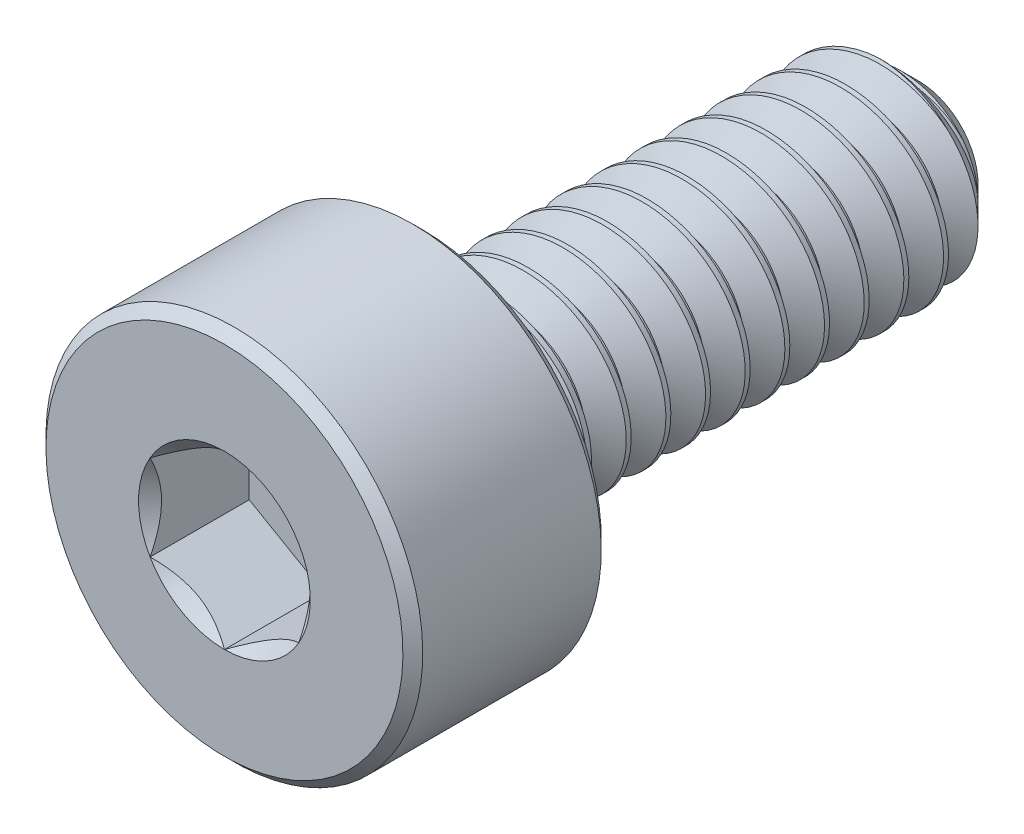
from build123d import *

# Parameters (mm, degrees)
CUT_EXTRUDE1_DEPTH = 1
CUT_SWEEP1_PITCH   = 0.4
CUT_SWEEP1_TO      = 5


with BuildPart() as part:
    # Sketch2 → Revolve1 (revolve)
    with BuildSketch(Plane(origin=(0, 0, 0), x_dir=(0, 0, -1), z_dir=(1, 0, 0))):
        Polygon((-3.5, 0), (-3.5, 1.8), (-3.4, 1.9), (-1.6, 1.9), (-1.5, 1.8), (-1.5, 1), (3.1, 1), (3.5, 0.6), (3.5, 0), align=None)
    revolve(axis=Axis((0, 0, -3.5), (0, 0, 1)))

    # Sketch3 → Cut-Extrude1 (cut)
    with BuildSketch(Plane.XY.offset(3.5)):
        Polygon((0.75, -0.433012702), (0.75, 0.433012702), (0, 0.866025404), (-0.75, 0.433012702), (-0.75, -0.433012702), (0, -0.866025404), align=None)
    extrude(amount=-CUT_EXTRUDE1_DEPTH, mode=Mode.SUBTRACT)

    # Cut-Extrude2 cone 1 section (through the dimple's axis) → Cut-Extrude2 (revolve, cut)
    with BuildSketch(Plane(origin=(0, 0, 3.5), x_dir=(0, -1, 0), z_dir=(1, 0, 0))):
        Polygon((0, 0), (0.866025404, 0), (0, 0.866025404), align=None)
    revolve(axis=Axis((0, 0, 3.5), (0, 0, -1)), mode=Mode.SUBTRACT)


with BuildPart() as body_2:
    # Split1: read off the stored shape, not the designer's step
    # Split1: the piece on the far side of the plane
    add(part.part)
    split(bisect_by=Plane.XY.offset(1.5), keep=Keep.BOTTOM)

    # Cut-Sweep1: arcs per turn and ends read off the stored shape
    # Cut-Sweep1: the profile of Sketch7 screwed along a right-hand helix through 13.65 turns, 6 arcs to a turn; built about Z, then put on its axis
    cut_sweep1_z = Axis((0, 0, 0), (0, 0, 1))
    cut_sweep1_corners = [(1.021650635, 0, 0.0125), (1.021650635, 0, -0.3625), (0.740192379, 0, -0.2), (0.740192379, 0, -0.15)]
    with BuildLine(mode=Mode.PRIVATE) as cut_sweep1_profile:
        Line(cut_sweep1_corners[0], cut_sweep1_corners[1])
        Line(cut_sweep1_corners[1], cut_sweep1_corners[2])
        Line(cut_sweep1_corners[2], cut_sweep1_corners[3])
        Line(cut_sweep1_corners[3], cut_sweep1_corners[0])
    cut_sweep1_cap = Face(cut_sweep1_profile.wire())
    cut_sweep1_turn_angles = [0, 30, 60, 90, 120, 150, 180, 210, 240, 270, 300, 330, 360]
    cut_sweep1_turn_weights = [1, 0.8660254037844387, 1, 0.8660254037844387, 1, 0.8660254037844387, 1, 0.8660254037844387, 1, 0.8660254037844387, 1, 0.8660254037844387, 1]
    cut_sweep1_turn_rails = [Edge.make_bspline([Vector(p[0], p[1], 0).rotate(cut_sweep1_z, cut_sweep1_turn_angles[k]) / cut_sweep1_turn_weights[k] + Vector(0, 0, p[2] + CUT_SWEEP1_PITCH * cut_sweep1_turn_angles[k] / 360) for k in range(13)], [0, 0, 0, 1, 1, 2, 2, 3, 3, 4, 4, 5, 5, 6, 6, 6], 2, cut_sweep1_turn_weights) for p in cut_sweep1_corners]
    cut_sweep1_turn_sides = [Face.make_surface_from_curves(cut_sweep1_turn_rails[p[0]], cut_sweep1_turn_rails[p[1]]) for p in [(0, 1), (1, 2), (2, 3), (3, 0)]]
    cut_sweep1_last_angles = [4680, 4710, 4740, 4770, 4800, 4830, 4860, 4887, 4914]
    cut_sweep1_last_weights = [1, 0.8660254037844387, 1, 0.8660254037844387, 1, 0.8660254037844387, 1, 0.8910065241882742, 1]
    cut_sweep1_last_rails = [Edge.make_bspline([Vector(p[0], p[1], 0).rotate(cut_sweep1_z, cut_sweep1_last_angles[k]) / cut_sweep1_last_weights[k] + Vector(0, 0, p[2] + CUT_SWEEP1_PITCH * cut_sweep1_last_angles[k] / 360) for k in range(9)], [0, 0, 0, 1, 1, 2, 2, 3, 3, 4, 4, 4], 2, cut_sweep1_last_weights) for p in cut_sweep1_corners]
    cut_sweep1_last_sides = [Face.make_surface_from_curves(cut_sweep1_last_rails[p[0]], cut_sweep1_last_rails[p[1]]) for p in [(0, 1), (1, 2), (2, 3), (3, 0)]]
    cut_sweep1 = Plane(origin=(0, 0, -3.5), x_dir=(0, 1, 0), z_dir=(0, 0, 1)) * split(Solid(Shell([*[p.moved(Location((0, 0, CUT_SWEEP1_PITCH * i))) for i in range(13) for p in cut_sweep1_turn_sides], *cut_sweep1_last_sides, cut_sweep1_cap, cut_sweep1_cap.rotate(cut_sweep1_z, 4914).moved(Location((0, 0, CUT_SWEEP1_PITCH * 4914 / 360)))])), bisect_by=Plane.XY.offset(CUT_SWEEP1_TO), keep=Keep.BOTTOM, mode=Mode.PRIVATE)
    add(cut_sweep1, mode=Mode.SUBTRACT)


with BuildPart() as part_1:
    add(part.part)

    # Split1
    split(bisect_by=Plane.XY.offset(1.5), keep=Keep.TOP)

    add(body_2.part)  # Boss-Extrude1 merges body 2
    # Boss-Extrude1 cone 1 section (through the dimple's axis) → Boss-Extrude1 (revolve)
    with BuildSketch(Plane(origin=(0, 0, 1.5), x_dir=(0, -1, 0), z_dir=(1, 0, 0))):
        Polygon((0, 0), (1, 0), (0, 1), align=None)
    revolve(axis=Axis((0, 0, 1.5), (0, 0, -1)))


solid = part_1.part
